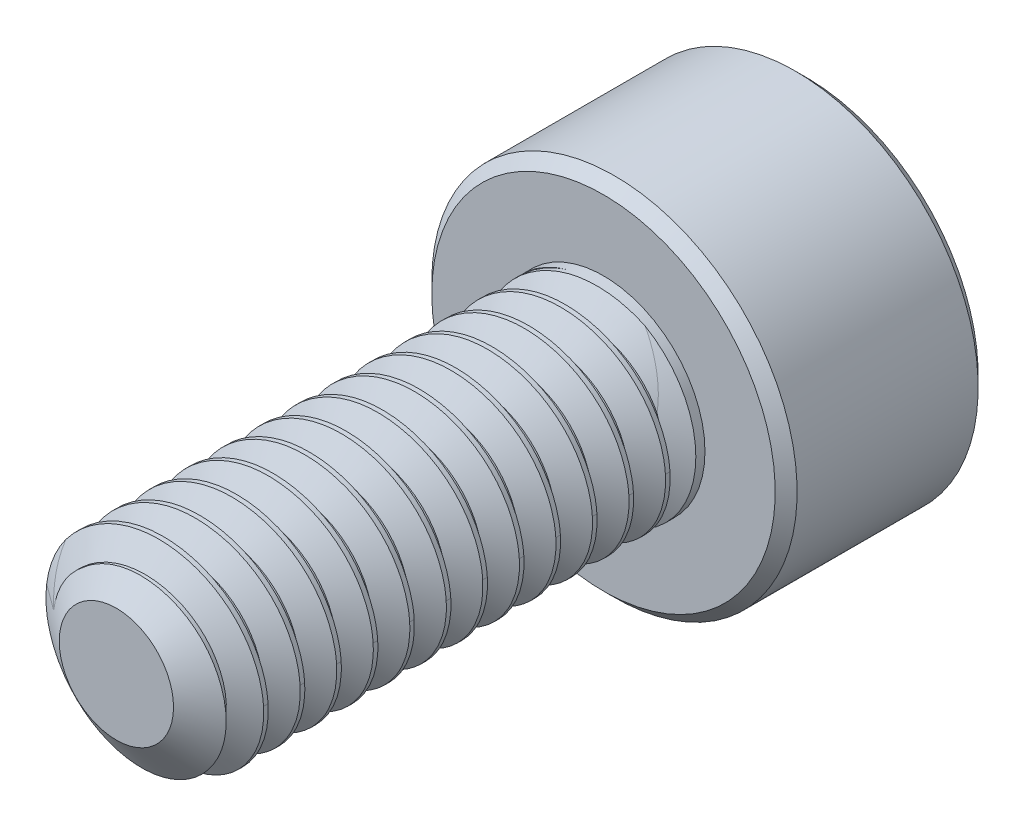
from build123d import *

# Parameters (mm, degrees)
SKETCH1_R          = 1.25
EXTRUDE1_DEPTH     = 6
CUT_SWEEP1_PITCH   = 0.45
SKETCH6_R          = 2.25
EXTRUDE2_DEPTH     = 2.5
CUT_EXTRUDE1_DEPTH = 1.5
CHAMFER1_SIZE      = 0.135


with BuildPart() as part:
    # Sketch1 → Extrude1 (new body)
    with BuildSketch(Plane.XY):
        Circle(SKETCH1_R)
    extrude(amount=-EXTRUDE1_DEPTH)

    # Cut-Sweep1: arcs per turn and ends read off the stored shape
    # Cut-Sweep1: the profile of Sketch3 profile screwed along a right-hand helix through 16 turns, 6 arcs to a turn; built about Z, then put on its axis
    cut_sweep1_z = Axis((0, 0, 0), (0, 0, 1))
    cut_sweep1_corners = [(1.2503, 0, -0.843923205), (0.957716426, 0, -0.675), (0.957716426, 0, -0.61875), (1.2503, 0, -0.449826795)]
    with BuildLine(mode=Mode.PRIVATE) as cut_sweep1_profile:
        Line(cut_sweep1_corners[0], cut_sweep1_corners[1])
        Line(cut_sweep1_corners[1], cut_sweep1_corners[2])
        Line(cut_sweep1_corners[2], cut_sweep1_corners[3])
        Line(cut_sweep1_corners[3], cut_sweep1_corners[0])
    cut_sweep1_cap = Face(cut_sweep1_profile.wire())
    cut_sweep1_turn_angles = [0, 30, 60, 90, 120, 150, 180, 210, 240, 270, 300, 330, 360]
    cut_sweep1_turn_weights = [1, 0.8660254037844387, 1, 0.8660254037844387, 1, 0.8660254037844387, 1, 0.8660254037844387, 1, 0.8660254037844387, 1, 0.8660254037844387, 1]
    cut_sweep1_turn_rails = [Edge.make_bspline([Vector(p[0], p[1], 0).rotate(cut_sweep1_z, cut_sweep1_turn_angles[k]) / cut_sweep1_turn_weights[k] + Vector(0, 0, p[2] + CUT_SWEEP1_PITCH * cut_sweep1_turn_angles[k] / 360) for k in range(13)], [0, 0, 0, 1, 1, 2, 2, 3, 3, 4, 4, 5, 5, 6, 6, 6], 2, cut_sweep1_turn_weights) for p in cut_sweep1_corners]
    cut_sweep1_turn_sides = [Face.make_surface_from_curves(cut_sweep1_turn_rails[p[0]], cut_sweep1_turn_rails[p[1]]) for p in [(0, 1), (1, 2), (2, 3), (3, 0)]]
    cut_sweep1 = Plane(origin=(0, 0, 0), x_dir=(0, 1, 0), z_dir=(0, 0, -1)) * Solid(Shell([*[p.moved(Location((0, 0, CUT_SWEEP1_PITCH * i))) for i in range(16) for p in cut_sweep1_turn_sides], cut_sweep1_cap, cut_sweep1_cap.rotate(cut_sweep1_z, 5760).moved(Location((0, 0, CUT_SWEEP1_PITCH * 5760 / 360)))]))
    add(cut_sweep1, mode=Mode.SUBTRACT)

    # Sketch4 → Cut-Revolve1 (revolve, cut)
    with BuildSketch(Plane(origin=(0, 0, 0), x_dir=(0, 0, -1), z_dir=(1, 0, 0)), mode=Mode.PRIVATE) as cut_revolve1_sk:
        Polygon((0.382511876, 1.25), (0, 0.703716426), (0, 1.25), align=None)
    revolve(cut_revolve1_sk.sketch.rotate(Axis((0, 0, 0), (0, 0, -1)), 90), axis=Axis((0, 0, 0), (0, 0, -1)), mode=Mode.SUBTRACT)

    # Sketch6 → Extrude2 (add)
    with BuildSketch(Plane(origin=(0, 0, -6), x_dir=(-1, 0, 0), z_dir=(0, 0, -1))):
        Circle(SKETCH6_R)
    extrude(amount=EXTRUDE2_DEPTH)

    # Sketch7 → Cut-Extrude1 (cut)
    with BuildSketch(Plane(origin=(0, 0, -8.5), x_dir=(-1, 0, 0), z_dir=(0, 0, -1))):
        Polygon((0, 1.154700538), (-1, 0.577350269), (-1, -0.577350269), (0, -1.154700538), (1, -0.577350269), (1, 0.577350269), align=None)
    extrude(amount=-CUT_EXTRUDE1_DEPTH, mode=Mode.SUBTRACT)

    # Cut-Extrude2 cone 1 section (through the dimple's axis) → Cut-Extrude2 (revolve, cut)
    with BuildSketch(Plane(origin=(0, 0, -8.5), x_dir=(0, 1, 0), z_dir=(1, 0, 0))):
        Polygon((0, 0), (1.154700538, 0), (0, 1.154700538), align=None)
    revolve(axis=Axis((0, 0, -8.5), (0, 0, 1)), mode=Mode.SUBTRACT)

    # Chamfer1
    chamfer1_edges = [part.edges().sort_by_distance(p)[0] for p in [
        (2.25, 0, -6),
        (2.25, 0, -8.5),
    ]]
    chamfer(chamfer1_edges, length=CHAMFER1_SIZE)

    # Sketch10 → Revolve1 (revolve)
    with BuildSketch(Plane(origin=(0, 0, 0), x_dir=(0, 0, -1), z_dir=(1, 0, 0)), mode=Mode.PRIVATE) as revolve1_sk:
        Polygon((6, 1.25), (6, 0), (5.369733047, 0), (5.8875, 1.25), align=None)
    revolve(revolve1_sk.sketch.rotate(Axis((0, 0, -6), (0, 0, 1)), 270), axis=Axis((0, 0, -6), (0, 0, 1)))


solid = part.part
